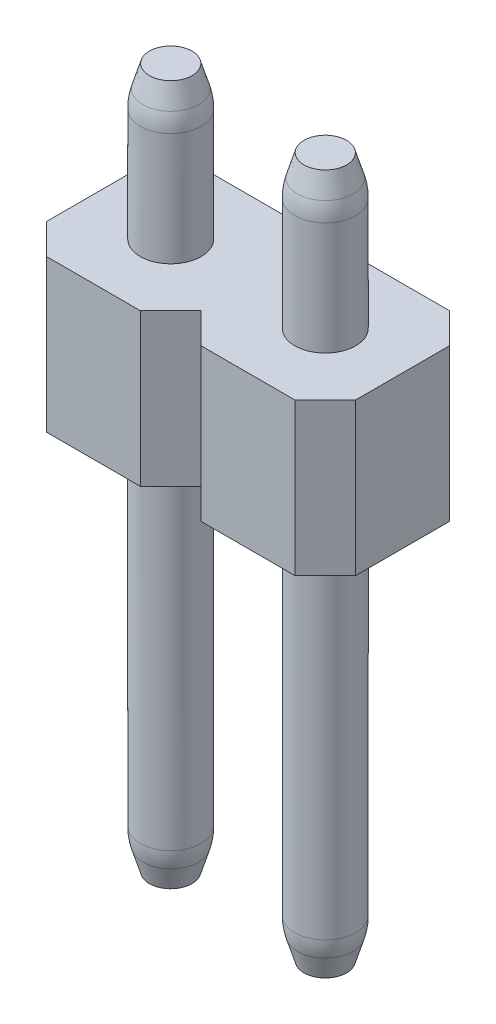
from build123d import *
from OCP.BRepFilletAPI import BRepFilletAPI_MakeChamfer

# Parameters (mm, degrees)
SKETCH1_R               = 0.5
BOSS_EXTRUDE1_DEPTH     = 11.5
BOSS_EXTRUDE1_2_DEPTH   = 11.5
BOSS_EXTRUDE1_3_DEPTH   = 11.5
BOSS_EXTRUDE1_4_DEPTH   = 11.5
BOSS_EXTRUDE1_5_DEPTH   = 11.5
BOSS_EXTRUDE1_6_DEPTH   = 11.5
BOSS_EXTRUDE1_7_DEPTH   = 11.5
BOSS_EXTRUDE1_8_DEPTH   = 11.5
BOSS_EXTRUDE1_9_DEPTH   = 11.5
BOSS_EXTRUDE1_10_DEPTH  = 11.5
BOSS_EXTRUDE1_11_DEPTH  = 11.5
BOSS_EXTRUDE1_12_DEPTH  = 11.5
BOSS_EXTRUDE1_13_DEPTH  = 11.5
BOSS_EXTRUDE1_14_DEPTH  = 11.5
BOSS_EXTRUDE1_15_DEPTH  = 11.5
BOSS_EXTRUDE1_16_DEPTH  = 11.5
BOSS_EXTRUDE2_DEPTH     = 2.5
CHAMFER1_SIZE           = 0.5
CHAMFER1_SIZE2          = 0.15
FILLET1_R               = 1
CHAMFER2_SIZE           = 0.15
CHAMFER2_SIZE2          = 0.5
FILLET2_R               = 1
CUT_EXTRUDE1_DEPTH      = 42.093776929
CUT_EXTRUDE2_DEPTH      = 32.494851997
CUT_EXTRUDE3_DEPTH      = 21.280081417
CUT_EXTRUDE3_DEPTH_BACK = 21.280081417
SKETCH5_W               = 12.7
SKETCH5_H               = 11.5


with BuildPart() as part:
    # Sketch1 → Boss-Extrude1 (new body)
    with BuildSketch(Plane(origin=(0, 0, 0), x_dir=(1, 0, 0), z_dir=(0, 1, 0))):
        Circle(SKETCH1_R)
    extrude(amount=BOSS_EXTRUDE1_DEPTH)



with BuildPart() as body_2:
    # Sketch1 → Boss-Extrude1 2 (new body)
    with BuildSketch(Plane(origin=(0, 0, 0), x_dir=(1, 0, 0), z_dir=(0, 1, 0))):
        with Locations((2.54, 0)):
            Circle(SKETCH1_R)
    extrude(amount=BOSS_EXTRUDE1_2_DEPTH)


with BuildPart() as body_3:
    # Sketch1 → Boss-Extrude1 3 (new body)
    with BuildSketch(Plane(origin=(0, 0, 0), x_dir=(1, 0, 0), z_dir=(0, 1, 0))):
        with Locations((5.08, 0)):
            Circle(SKETCH1_R)
    extrude(amount=BOSS_EXTRUDE1_3_DEPTH)


with BuildPart() as body_4:
    # Sketch1 → Boss-Extrude1 4 (new body)
    with BuildSketch(Plane(origin=(0, 0, 0), x_dir=(1, 0, 0), z_dir=(0, 1, 0))):
        with Locations((7.62, 0)):
            Circle(SKETCH1_R)
    extrude(amount=BOSS_EXTRUDE1_4_DEPTH)


with BuildPart() as body_5:
    # Sketch1 → Boss-Extrude1 5 (new body)
    with BuildSketch(Plane(origin=(0, 0, 0), x_dir=(1, 0, 0), z_dir=(0, 1, 0))):
        with Locations((10.16, 0)):
            Circle(SKETCH1_R)
    extrude(amount=BOSS_EXTRUDE1_5_DEPTH)


with BuildPart() as body_6:
    # Sketch1 → Boss-Extrude1 6 (new body)
    with BuildSketch(Plane(origin=(0, 0, 0), x_dir=(1, 0, 0), z_dir=(0, 1, 0))):
        with Locations((12.7, 0)):
            Circle(SKETCH1_R)
    extrude(amount=BOSS_EXTRUDE1_6_DEPTH)


with BuildPart() as body_7:
    # Sketch1 → Boss-Extrude1 7 (new body)
    with BuildSketch(Plane(origin=(0, 0, 0), x_dir=(1, 0, 0), z_dir=(0, 1, 0))):
        with Locations((15.24, 0)):
            Circle(SKETCH1_R)
    extrude(amount=BOSS_EXTRUDE1_7_DEPTH)


with BuildPart() as body_8:
    # Sketch1 → Boss-Extrude1 8 (new body)
    with BuildSketch(Plane(origin=(0, 0, 0), x_dir=(1, 0, 0), z_dir=(0, 1, 0))):
        with Locations((17.78, 0)):
            Circle(SKETCH1_R)
    extrude(amount=BOSS_EXTRUDE1_8_DEPTH)


with BuildPart() as body_9:
    # Sketch1 → Boss-Extrude1 9 (new body)
    with BuildSketch(Plane(origin=(0, 0, 0), x_dir=(1, 0, 0), z_dir=(0, 1, 0))):
        with Locations((20.32, 0)):
            Circle(SKETCH1_R)
    extrude(amount=BOSS_EXTRUDE1_9_DEPTH)


with BuildPart() as body_10:
    # Sketch1 → Boss-Extrude1 10 (new body)
    with BuildSketch(Plane(origin=(0, 0, 0), x_dir=(1, 0, 0), z_dir=(0, 1, 0))):
        with Locations((22.86, 0)):
            Circle(SKETCH1_R)
    extrude(amount=BOSS_EXTRUDE1_10_DEPTH)


with BuildPart() as body_11:
    # Sketch1 → Boss-Extrude1 11 (new body)
    with BuildSketch(Plane(origin=(0, 0, 0), x_dir=(1, 0, 0), z_dir=(0, 1, 0))):
        with Locations((25.4, 0)):
            Circle(SKETCH1_R)
    extrude(amount=BOSS_EXTRUDE1_11_DEPTH)


with BuildPart() as body_12:
    # Sketch1 → Boss-Extrude1 12 (new body)
    with BuildSketch(Plane(origin=(0, 0, 0), x_dir=(1, 0, 0), z_dir=(0, 1, 0))):
        with Locations((27.94, 0)):
            Circle(SKETCH1_R)
    extrude(amount=BOSS_EXTRUDE1_12_DEPTH)


with BuildPart() as body_13:
    # Sketch1 → Boss-Extrude1 13 (new body)
    with BuildSketch(Plane(origin=(0, 0, 0), x_dir=(1, 0, 0), z_dir=(0, 1, 0))):
        with Locations((30.48, 0)):
            Circle(SKETCH1_R)
    extrude(amount=BOSS_EXTRUDE1_13_DEPTH)


with BuildPart() as body_14:
    # Sketch1 → Boss-Extrude1 14 (new body)
    with BuildSketch(Plane(origin=(0, 0, 0), x_dir=(1, 0, 0), z_dir=(0, 1, 0))):
        with Locations((33.02, 0)):
            Circle(SKETCH1_R)
    extrude(amount=BOSS_EXTRUDE1_14_DEPTH)


with BuildPart() as body_15:
    # Sketch1 → Boss-Extrude1 15 (new body)
    with BuildSketch(Plane(origin=(0, 0, 0), x_dir=(1, 0, 0), z_dir=(0, 1, 0))):
        with Locations((35.56, 0)):
            Circle(SKETCH1_R)
    extrude(amount=BOSS_EXTRUDE1_15_DEPTH)


with BuildPart() as body_16:
    # Sketch1 → Boss-Extrude1 16 (new body)
    with BuildSketch(Plane(origin=(0, 0, 0), x_dir=(1, 0, 0), z_dir=(0, 1, 0))):
        with Locations((38.1, 0)):
            Circle(SKETCH1_R)
    extrude(amount=BOSS_EXTRUDE1_16_DEPTH)


with BuildPart() as part_1:
    add(part.part)

    add(body_2.part)  # Boss-Extrude2 merges body 2

    add(body_3.part)  # Boss-Extrude2 merges body 3

    add(body_4.part)  # Boss-Extrude2 merges body 4

    add(body_5.part)  # Boss-Extrude2 merges body 5

    add(body_6.part)  # Boss-Extrude2 merges body 6

    add(body_7.part)  # Boss-Extrude2 merges body 7

    add(body_8.part)  # Boss-Extrude2 merges body 8

    add(body_9.part)  # Boss-Extrude2 merges body 9

    add(body_10.part)  # Boss-Extrude2 merges body 10

    add(body_11.part)  # Boss-Extrude2 merges body 11

    add(body_12.part)  # Boss-Extrude2 merges body 12

    add(body_13.part)  # Boss-Extrude2 merges body 13

    add(body_14.part)  # Boss-Extrude2 merges body 14

    add(body_15.part)  # Boss-Extrude2 merges body 15

    add(body_16.part)  # Boss-Extrude2 merges body 16
    # Sketch2 → Boss-Extrude2 (add)
    with BuildSketch(Plane(origin=(0, 6.5, 0), x_dir=(1, 0, 0), z_dir=(0, 1, 0))):
        Polygon((-1.27, 0.77), (-0.77, 1.27), (0.77, 1.27), (1.27, 0.77), (1.77, 1.27), (3.31, 1.27), (3.81, 0.77), (4.31, 1.27), (5.85, 1.27), (6.35, 0.77), (6.85, 1.27), (8.39, 1.27), (8.89, 0.77), (9.39, 1.27), (10.93, 1.27), (11.43, 0.77), (11.93, 1.27), (13.47, 1.27), (13.97, 0.77), (14.47, 1.27), (16.01, 1.27), (16.51, 0.77), (17.01, 1.27), (18.55, 1.27), (19.05, 0.77), (19.55, 1.27), (21.09, 1.27), (21.59, 0.77), (22.09, 1.27), (23.63, 1.27), (24.13, 0.77), (24.63, 1.27), (26.17, 1.27), (26.67, 0.77), (27.17, 1.27), (28.71, 1.27), (29.21, 0.77), (29.71, 1.27), (31.25, 1.27), (31.75, 0.77), (32.25, 1.27), (33.79, 1.27), (34.29, 0.77), (34.79, 1.27), (36.33, 1.27), (36.83, 0.77), (37.33, 1.27), (38.87, 1.27), (39.37, 0.77), (39.37, -0.77), (38.87, -1.27), (37.33, -1.27), (36.83, -0.77), (36.33, -1.27), (34.79, -1.27), (34.29, -0.77), (33.79, -1.27), (32.25, -1.27), (31.75, -0.77), (31.25, -1.27), (29.71, -1.27), (29.21, -0.77), (28.71, -1.27), (27.17, -1.27), (26.67, -0.77), (26.17, -1.27), (24.63, -1.27), (24.13, -0.77), (23.63, -1.27), (22.09, -1.27), (21.59, -0.77), (21.09, -1.27), (19.55, -1.27), (19.05, -0.77), (18.55, -1.27), (17.01, -1.27), (16.51, -0.77), (16.01, -1.27), (14.47, -1.27), (13.97, -0.77), (13.47, -1.27), (11.93, -1.27), (11.43, -0.77), (10.93, -1.27), (9.39, -1.27), (8.89, -0.77), (8.39, -1.27), (6.85, -1.27), (6.35, -0.77), (5.85, -1.27), (4.31, -1.27), (3.81, -0.77), (3.31, -1.27), (1.77, -1.27), (1.27, -0.77), (0.77, -1.27), (-0.77, -1.27), (-1.27, -0.77), align=None)
    extrude(amount=BOSS_EXTRUDE2_DEPTH)

    # Chamfer1: one chamfer whose edges measure the first distance from different faces: ONE call of the kernel's chamfer builder (chamfer() names one face for all edges)
    chamfer1_edges_1 = [part_1.edges().sort_by_distance(p)[0] for p in [
        (14.74, 11.5, 0),
    ]]
    chamfer1_side_1 = [part_1.faces().sort_by_distance(p)[0] for p in [
        (14.74, 10.25, 0),
    ]]
    chamfer1_edges_2 = [part_1.edges().sort_by_distance(p)[0] for p in [
        (12.2, 11.5, 0),
    ]]
    chamfer1_side_2 = [part_1.faces().sort_by_distance(p)[0] for p in [
        (12.2, 10.25, 0),
    ]]
    chamfer1_edges_3 = [part_1.edges().sort_by_distance(p)[0] for p in [
        (9.66, 11.5, 0),
    ]]
    chamfer1_side_3 = [part_1.faces().sort_by_distance(p)[0] for p in [
        (9.66, 10.25, 0),
    ]]
    chamfer1_edges_4 = [part_1.edges().sort_by_distance(p)[0] for p in [
        (7.12, 11.5, 0),
    ]]
    chamfer1_side_4 = [part_1.faces().sort_by_distance(p)[0] for p in [
        (7.12, 10.25, 0),
    ]]
    chamfer1_edges_5 = [part_1.edges().sort_by_distance(p)[0] for p in [
        (4.58, 11.5, 0),
    ]]
    chamfer1_side_5 = [part_1.faces().sort_by_distance(p)[0] for p in [
        (4.58, 10.25, 0),
    ]]
    chamfer1_edges_6 = [part_1.edges().sort_by_distance(p)[0] for p in [
        (2.04, 11.5, 0),
    ]]
    chamfer1_side_6 = [part_1.faces().sort_by_distance(p)[0] for p in [
        (2.04, 10.25, 0),
    ]]
    chamfer1_edges_7 = [part_1.edges().sort_by_distance(p)[0] for p in [
        (-0.5, 11.5, 0),
    ]]
    chamfer1_side_7 = [part_1.faces().sort_by_distance(p)[0] for p in [
        (-0.5, 10.25, 0),
    ]]
    chamfer1_edges_8 = [part_1.edges().sort_by_distance(p)[0] for p in [
        (37.6, 11.5, 0),
    ]]
    chamfer1_side_8 = [part_1.faces().sort_by_distance(p)[0] for p in [
        (37.6, 10.25, 0),
    ]]
    chamfer1_edges_9 = [part_1.edges().sort_by_distance(p)[0] for p in [
        (35.06, 11.5, 0),
    ]]
    chamfer1_side_9 = [part_1.faces().sort_by_distance(p)[0] for p in [
        (35.06, 10.25, 0),
    ]]
    chamfer1_edges_10 = [part_1.edges().sort_by_distance(p)[0] for p in [
        (32.52, 11.5, 0),
    ]]
    chamfer1_side_10 = [part_1.faces().sort_by_distance(p)[0] for p in [
        (32.52, 10.25, 0),
    ]]
    chamfer1_edges_11 = [part_1.edges().sort_by_distance(p)[0] for p in [
        (29.98, 11.5, 0),
    ]]
    chamfer1_side_11 = [part_1.faces().sort_by_distance(p)[0] for p in [
        (29.98, 10.25, 0),
    ]]
    chamfer1_edges_12 = [part_1.edges().sort_by_distance(p)[0] for p in [
        (27.44, 11.5, 0),
    ]]
    chamfer1_side_12 = [part_1.faces().sort_by_distance(p)[0] for p in [
        (27.44, 10.25, 0),
    ]]
    chamfer1_edges_13 = [part_1.edges().sort_by_distance(p)[0] for p in [
        (24.9, 11.5, 0),
    ]]
    chamfer1_side_13 = [part_1.faces().sort_by_distance(p)[0] for p in [
        (24.9, 10.25, 0),
    ]]
    chamfer1_edges_14 = [part_1.edges().sort_by_distance(p)[0] for p in [
        (22.36, 11.5, 0),
    ]]
    chamfer1_side_14 = [part_1.faces().sort_by_distance(p)[0] for p in [
        (22.36, 10.25, 0),
    ]]
    chamfer1_edges_15 = [part_1.edges().sort_by_distance(p)[0] for p in [
        (19.82, 11.5, 0),
    ]]
    chamfer1_side_15 = [part_1.faces().sort_by_distance(p)[0] for p in [
        (19.82, 10.25, 0),
    ]]
    chamfer1_edges_16 = [part_1.edges().sort_by_distance(p)[0] for p in [
        (17.28, 11.5, 0),
    ]]
    chamfer1_side_16 = [part_1.faces().sort_by_distance(p)[0] for p in [
        (17.28, 10.25, 0),
    ]]
    chamfer1 = BRepFilletAPI_MakeChamfer(part_1.part.solid().wrapped)
    for e in chamfer1_edges_1:
        chamfer1.Add(CHAMFER1_SIZE, CHAMFER1_SIZE2, e.wrapped, chamfer1_side_1[0].wrapped)  # the first distance lies on this face
    for e in chamfer1_edges_2:
        chamfer1.Add(CHAMFER1_SIZE, CHAMFER1_SIZE2, e.wrapped, chamfer1_side_2[0].wrapped)  # the first distance lies on this face
    for e in chamfer1_edges_3:
        chamfer1.Add(CHAMFER1_SIZE, CHAMFER1_SIZE2, e.wrapped, chamfer1_side_3[0].wrapped)  # the first distance lies on this face
    for e in chamfer1_edges_4:
        chamfer1.Add(CHAMFER1_SIZE, CHAMFER1_SIZE2, e.wrapped, chamfer1_side_4[0].wrapped)  # the first distance lies on this face
    for e in chamfer1_edges_5:
        chamfer1.Add(CHAMFER1_SIZE, CHAMFER1_SIZE2, e.wrapped, chamfer1_side_5[0].wrapped)  # the first distance lies on this face
    for e in chamfer1_edges_6:
        chamfer1.Add(CHAMFER1_SIZE, CHAMFER1_SIZE2, e.wrapped, chamfer1_side_6[0].wrapped)  # the first distance lies on this face
    for e in chamfer1_edges_7:
        chamfer1.Add(CHAMFER1_SIZE, CHAMFER1_SIZE2, e.wrapped, chamfer1_side_7[0].wrapped)  # the first distance lies on this face
    for e in chamfer1_edges_8:
        chamfer1.Add(CHAMFER1_SIZE, CHAMFER1_SIZE2, e.wrapped, chamfer1_side_8[0].wrapped)  # the first distance lies on this face
    for e in chamfer1_edges_9:
        chamfer1.Add(CHAMFER1_SIZE, CHAMFER1_SIZE2, e.wrapped, chamfer1_side_9[0].wrapped)  # the first distance lies on this face
    for e in chamfer1_edges_10:
        chamfer1.Add(CHAMFER1_SIZE, CHAMFER1_SIZE2, e.wrapped, chamfer1_side_10[0].wrapped)  # the first distance lies on this face
    for e in chamfer1_edges_11:
        chamfer1.Add(CHAMFER1_SIZE, CHAMFER1_SIZE2, e.wrapped, chamfer1_side_11[0].wrapped)  # the first distance lies on this face
    for e in chamfer1_edges_12:
        chamfer1.Add(CHAMFER1_SIZE, CHAMFER1_SIZE2, e.wrapped, chamfer1_side_12[0].wrapped)  # the first distance lies on this face
    for e in chamfer1_edges_13:
        chamfer1.Add(CHAMFER1_SIZE, CHAMFER1_SIZE2, e.wrapped, chamfer1_side_13[0].wrapped)  # the first distance lies on this face
    for e in chamfer1_edges_14:
        chamfer1.Add(CHAMFER1_SIZE, CHAMFER1_SIZE2, e.wrapped, chamfer1_side_14[0].wrapped)  # the first distance lies on this face
    for e in chamfer1_edges_15:
        chamfer1.Add(CHAMFER1_SIZE, CHAMFER1_SIZE2, e.wrapped, chamfer1_side_15[0].wrapped)  # the first distance lies on this face
    for e in chamfer1_edges_16:
        chamfer1.Add(CHAMFER1_SIZE, CHAMFER1_SIZE2, e.wrapped, chamfer1_side_16[0].wrapped)  # the first distance lies on this face
    add(Compound.cast(chamfer1.Shape()), mode=Mode.REPLACE)

    # Fillet1
    fillet1_edges = [part_1.edges().sort_by_distance(p)[0] for p in [
        (37.6, 11, 0),
        (35.06, 11, 0),
        (32.52, 11, 0),
        (29.98, 11, 0),
        (27.44, 11, 0),
        (24.9, 11, 0),
        (22.36, 11, 0),
        (19.82, 11, 0),
        (17.28, 11, 0),
        (14.74, 11, 0),
        (12.2, 11, 0),
        (9.66, 11, 0),
        (7.12, 11, 0),
        (4.58, 11, 0),
        (2.04, 11, 0),
        (-0.5, 11, 0),
    ]]
    fillet(fillet1_edges, radius=FILLET1_R)

    # Chamfer2: one chamfer whose edges measure the first distance from different faces: ONE call of the kernel's chamfer builder (chamfer() names one face for all edges)
    chamfer2_edges_1 = [part_1.edges().sort_by_distance(p)[0] for p in [
        (9.66, 0, 0),
    ]]
    chamfer2_side_1 = [part_1.faces().sort_by_distance(p)[0] for p in [
        (10.16, 0, 0),
    ]]
    chamfer2_edges_2 = [part_1.edges().sort_by_distance(p)[0] for p in [
        (17.28, 0, 0),
    ]]
    chamfer2_side_2 = [part_1.faces().sort_by_distance(p)[0] for p in [
        (17.78, 0, 0),
    ]]
    chamfer2_edges_3 = [part_1.edges().sort_by_distance(p)[0] for p in [
        (22.36, 0, 0),
    ]]
    chamfer2_side_3 = [part_1.faces().sort_by_distance(p)[0] for p in [
        (22.86, 0, 0),
    ]]
    chamfer2_edges_4 = [part_1.edges().sort_by_distance(p)[0] for p in [
        (27.44, 0, 0),
    ]]
    chamfer2_side_4 = [part_1.faces().sort_by_distance(p)[0] for p in [
        (27.94, 0, 0),
    ]]
    chamfer2_edges_5 = [part_1.edges().sort_by_distance(p)[0] for p in [
        (29.98, 0, 0),
    ]]
    chamfer2_side_5 = [part_1.faces().sort_by_distance(p)[0] for p in [
        (30.48, 0, 0),
    ]]
    chamfer2_edges_6 = [part_1.edges().sort_by_distance(p)[0] for p in [
        (-0.5, 0, 0),
    ]]
    chamfer2_side_6 = [part_1.faces().sort_by_distance(p)[0] for p in [
        (0, 0, 0),
    ]]
    chamfer2_edges_7 = [part_1.edges().sort_by_distance(p)[0] for p in [
        (2.04, 0, 0),
    ]]
    chamfer2_side_7 = [part_1.faces().sort_by_distance(p)[0] for p in [
        (2.54, 0, 0),
    ]]
    chamfer2_edges_8 = [part_1.edges().sort_by_distance(p)[0] for p in [
        (4.58, 0, 0),
    ]]
    chamfer2_side_8 = [part_1.faces().sort_by_distance(p)[0] for p in [
        (5.08, 0, 0),
    ]]
    chamfer2_edges_9 = [part_1.edges().sort_by_distance(p)[0] for p in [
        (7.12, 0, 0),
    ]]
    chamfer2_side_9 = [part_1.faces().sort_by_distance(p)[0] for p in [
        (7.62, 0, 0),
    ]]
    chamfer2_edges_10 = [part_1.edges().sort_by_distance(p)[0] for p in [
        (12.2, 0, 0),
    ]]
    chamfer2_side_10 = [part_1.faces().sort_by_distance(p)[0] for p in [
        (12.7, 0, 0),
    ]]
    chamfer2_edges_11 = [part_1.edges().sort_by_distance(p)[0] for p in [
        (14.74, 0, 0),
    ]]
    chamfer2_side_11 = [part_1.faces().sort_by_distance(p)[0] for p in [
        (15.24, 0, 0),
    ]]
    chamfer2_edges_12 = [part_1.edges().sort_by_distance(p)[0] for p in [
        (19.82, 0, 0),
    ]]
    chamfer2_side_12 = [part_1.faces().sort_by_distance(p)[0] for p in [
        (20.32, 0, 0),
    ]]
    chamfer2_edges_13 = [part_1.edges().sort_by_distance(p)[0] for p in [
        (24.9, 0, 0),
    ]]
    chamfer2_side_13 = [part_1.faces().sort_by_distance(p)[0] for p in [
        (25.4, 0, 0),
    ]]
    chamfer2_edges_14 = [part_1.edges().sort_by_distance(p)[0] for p in [
        (32.52, 0, 0),
    ]]
    chamfer2_side_14 = [part_1.faces().sort_by_distance(p)[0] for p in [
        (33.02, 0, 0),
    ]]
    chamfer2_edges_15 = [part_1.edges().sort_by_distance(p)[0] for p in [
        (35.06, 0, 0),
    ]]
    chamfer2_side_15 = [part_1.faces().sort_by_distance(p)[0] for p in [
        (35.56, 0, 0),
    ]]
    chamfer2_edges_16 = [part_1.edges().sort_by_distance(p)[0] for p in [
        (37.6, 0, 0),
    ]]
    chamfer2_side_16 = [part_1.faces().sort_by_distance(p)[0] for p in [
        (38.1, 0, 0),
    ]]
    chamfer2 = BRepFilletAPI_MakeChamfer(part_1.part.solid().wrapped)
    for e in chamfer2_edges_1:
        chamfer2.Add(CHAMFER2_SIZE, CHAMFER2_SIZE2, e.wrapped, chamfer2_side_1[0].wrapped)  # the first distance lies on this face
    for e in chamfer2_edges_2:
        chamfer2.Add(CHAMFER2_SIZE, CHAMFER2_SIZE2, e.wrapped, chamfer2_side_2[0].wrapped)  # the first distance lies on this face
    for e in chamfer2_edges_3:
        chamfer2.Add(CHAMFER2_SIZE, CHAMFER2_SIZE2, e.wrapped, chamfer2_side_3[0].wrapped)  # the first distance lies on this face
    for e in chamfer2_edges_4:
        chamfer2.Add(CHAMFER2_SIZE, CHAMFER2_SIZE2, e.wrapped, chamfer2_side_4[0].wrapped)  # the first distance lies on this face
    for e in chamfer2_edges_5:
        chamfer2.Add(CHAMFER2_SIZE, CHAMFER2_SIZE2, e.wrapped, chamfer2_side_5[0].wrapped)  # the first distance lies on this face
    for e in chamfer2_edges_6:
        chamfer2.Add(CHAMFER2_SIZE, CHAMFER2_SIZE2, e.wrapped, chamfer2_side_6[0].wrapped)  # the first distance lies on this face
    for e in chamfer2_edges_7:
        chamfer2.Add(CHAMFER2_SIZE, CHAMFER2_SIZE2, e.wrapped, chamfer2_side_7[0].wrapped)  # the first distance lies on this face
    for e in chamfer2_edges_8:
        chamfer2.Add(CHAMFER2_SIZE, CHAMFER2_SIZE2, e.wrapped, chamfer2_side_8[0].wrapped)  # the first distance lies on this face
    for e in chamfer2_edges_9:
        chamfer2.Add(CHAMFER2_SIZE, CHAMFER2_SIZE2, e.wrapped, chamfer2_side_9[0].wrapped)  # the first distance lies on this face
    for e in chamfer2_edges_10:
        chamfer2.Add(CHAMFER2_SIZE, CHAMFER2_SIZE2, e.wrapped, chamfer2_side_10[0].wrapped)  # the first distance lies on this face
    for e in chamfer2_edges_11:
        chamfer2.Add(CHAMFER2_SIZE, CHAMFER2_SIZE2, e.wrapped, chamfer2_side_11[0].wrapped)  # the first distance lies on this face
    for e in chamfer2_edges_12:
        chamfer2.Add(CHAMFER2_SIZE, CHAMFER2_SIZE2, e.wrapped, chamfer2_side_12[0].wrapped)  # the first distance lies on this face
    for e in chamfer2_edges_13:
        chamfer2.Add(CHAMFER2_SIZE, CHAMFER2_SIZE2, e.wrapped, chamfer2_side_13[0].wrapped)  # the first distance lies on this face
    for e in chamfer2_edges_14:
        chamfer2.Add(CHAMFER2_SIZE, CHAMFER2_SIZE2, e.wrapped, chamfer2_side_14[0].wrapped)  # the first distance lies on this face
    for e in chamfer2_edges_15:
        chamfer2.Add(CHAMFER2_SIZE, CHAMFER2_SIZE2, e.wrapped, chamfer2_side_15[0].wrapped)  # the first distance lies on this face
    for e in chamfer2_edges_16:
        chamfer2.Add(CHAMFER2_SIZE, CHAMFER2_SIZE2, e.wrapped, chamfer2_side_16[0].wrapped)  # the first distance lies on this face
    add(Compound.cast(chamfer2.Shape()), mode=Mode.REPLACE)

    # Fillet2
    fillet2_edges = [part_1.edges().sort_by_distance(p)[0] for p in [
        (29.98, 0.5, 0),
        (32.52, 0.5, 0),
        (35.06, 0.5, 0),
        (37.6, 0.5, 0),
        (27.44, 0.5, 0),
        (24.9, 0.5, 0),
        (22.36, 0.5, 0),
        (19.82, 0.5, 0),
        (17.28, 0.5, 0),
        (14.74, 0.5, 0),
        (12.2, 0.5, 0),
        (9.66, 0.5, 0),
        (7.12, 0.5, 0),
        (4.58, 0.5, 0),
        (2.04, 0.5, 0),
        (-0.5, 0.5, 0),
    ]]
    fillet(fillet2_edges, radius=FILLET2_R)

    # Sketch3 → Cut-Extrude1 (cut, through all)
    with BuildSketch(Plane.XY.offset(1.27)):
        Polygon((29.21, 9), (29.21, 6.5), (29.21, -0.904576426), (41.732415353, -0.904576426), (41.732415353, 12.006276544), (29.21, 12.006276544), align=None)
    extrude(amount=-CUT_EXTRUDE1_DEPTH, mode=Mode.SUBTRACT)

    # Sketch4 → Cut-Extrude2 (cut, through all)
    with BuildSketch(Plane.XY.offset(1.27)):
        Polygon((16.51, 9), (16.51, 6.5), (16.51, -1.163081692), (30.596050739, -1.163081692), (30.596050739, 12.130577479), (16.51, 12.130577479), align=None)
    extrude(amount=-CUT_EXTRUDE2_DEPTH, mode=Mode.SUBTRACT)

    # Sketch5 → Cut-Extrude3 (cut, two sides: drawn at the far end of the back side and taken through both)
    with BuildSketch(Plane.XY.offset(1.27).offset(-CUT_EXTRUDE3_DEPTH_BACK)):
        with Locations((10.16, 5.75)):
            Rectangle(SKETCH5_W, SKETCH5_H)
    extrude(amount=CUT_EXTRUDE3_DEPTH + CUT_EXTRUDE3_DEPTH_BACK, mode=Mode.SUBTRACT)


solid = part_1.part
